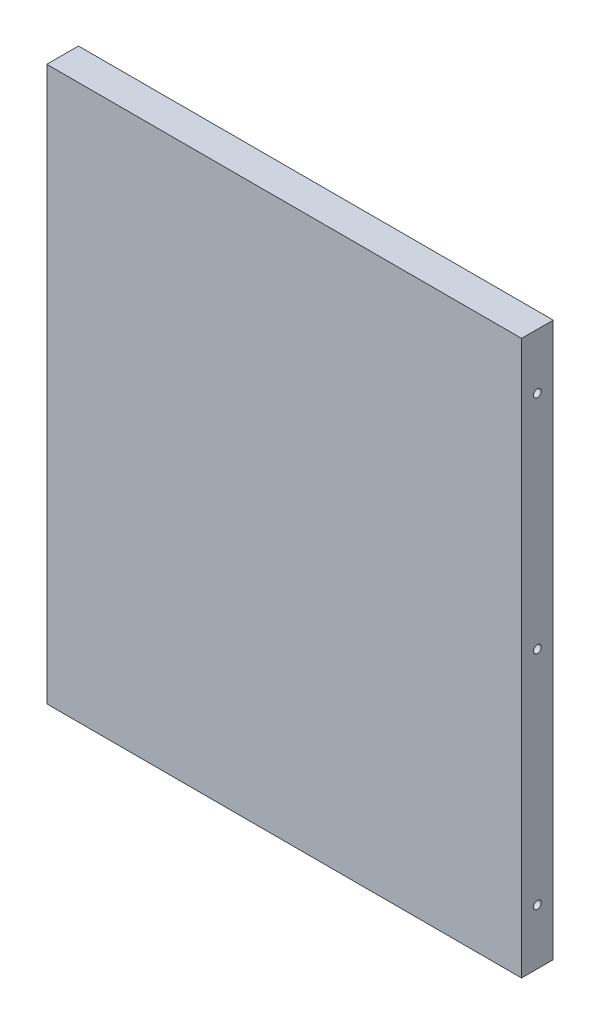
from build123d import *

# Parameters (mm, degrees)
SKIZZE1_W                       = 150
SKIZZE1_H                       = 175
AUFSATZ_LINEAR_AUSTRAGEN1_DEPTH = 10
SKIZZE2_R                       = 1.25
SKIZZE2_R_2                     = 1.23
SCHNITT_LINEAR_AUSTRAGEN1_DEPTH = 5
SCHNITT_LINEAR_START            = -5
SKIZZE3_R                       = 1.23
SCHNITT_LINEAR_AUSTRAGEN2_DEPTH = 5


with BuildPart() as part:
    # Skizze1 → Aufsatz-Linear austragen1 (new body)
    with BuildSketch(Plane.XY):
        with Locations((-9.70090245, -21.923076923)):
            Rectangle(SKIZZE1_W, SKIZZE1_H)
    extrude(amount=AUFSATZ_LINEAR_AUSTRAGEN1_DEPTH)

    # Skizze2 → Schnitt-Linear austragen1 (cut)
    with BuildSketch(Plane.ZY.offset(84.70090245)):
        with Locations((5, 48.076923077)):
            Circle(SKIZZE2_R)
        with Locations((5, -21.923076923)):
            Circle(SKIZZE2_R)
        with Locations((5, -91.923076923)):
            Circle(SKIZZE2_R_2)
    extrude(amount=-SCHNITT_LINEAR_AUSTRAGEN1_DEPTH, mode=Mode.SUBTRACT)

    # Skizze3 → Schnitt-Linear austragen2 (cut)
    with BuildSketch(Plane(origin=(65.29909755, 0, 0), x_dir=(0, 0, -1), z_dir=(1, 0, 0)).offset(SCHNITT_LINEAR_START)):
        with Locations((-5, 48.076923077)):
            Circle(SKIZZE3_R)
        with Locations((-5, -21.923076923)):
            Circle(SKIZZE3_R)
        with Locations((-5, -91.923076923)):
            Circle(SKIZZE3_R)
    extrude(amount=SCHNITT_LINEAR_AUSTRAGEN2_DEPTH, mode=Mode.SUBTRACT)


solid = part.part
